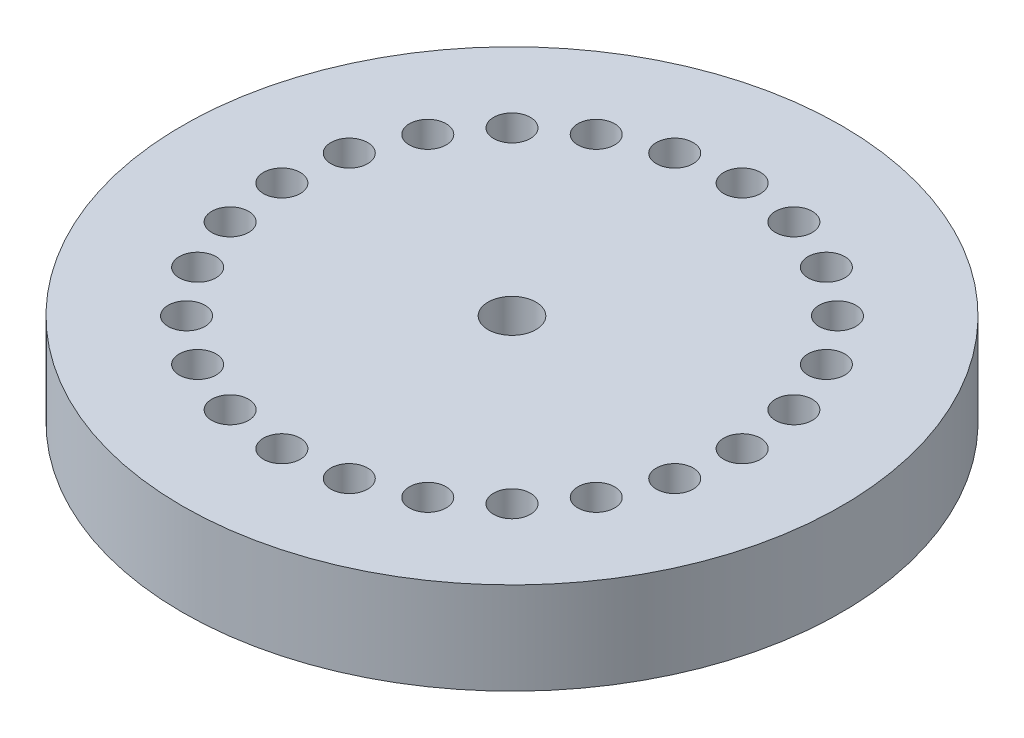
from build123d import *

# Parameters (mm, degrees)
SKETCH1_R                                        = 45.466
BOSS_EXTRUDE1_DEPTH                              = 25.4
SKETCH3_R                                        = 20.32
CUT_EXTRUDE1_DEPTH                               = 12.7
CSK_FOR_1_4_FLAT_HEAD_MACHINE_SCREW1_D           = 6.5278
CSK_FOR_1_4_FLAT_HEAD_MACHINE_SCREW1_DEPTH       = 25.4
CSK_FOR_1_4_FLAT_HEAD_MACHINE_SCREW1_CSINK_D     = 12.8778
CSK_FOR_1_4_FLAT_HEAD_MACHINE_SCREW1_CSINK_ANGLE = 82
CSK_FOR_1_4_FLAT_HEAD_MACHINE_SCREW1_TIP         = 1.961148974
SKETCH8_R                                        = 46.955588052
CUT_EXTRUDE2_DEPTH                               = 12.7
SKETCH4_R                                        = 1.778
CUT_EXTRUDE3_DEPTH                               = 66.540859866
SKETCH9_R                                        = 2.54
CUT_EXTRUDE4_DEPTH                               = 5.08
CIRPATTERN1_COUNT                                = 24
SKETCH10_R                                       = 22.834776664
BOSS_EXTRUDE2_DEPTH                              = 5.08
SKETCH11_R                                       = 3.302
CUT_EXTRUDE5_DEPTH                               = 66.540859866


with BuildPart() as part:
    # Sketch1 → Boss-Extrude1 (new body)
    with BuildSketch(Plane(origin=(0, 0, 0), x_dir=(1, 0, 0), z_dir=(0, 1, 0))):
        Circle(SKETCH1_R)
    extrude(amount=BOSS_EXTRUDE1_DEPTH)

    # Sketch3 → Cut-Extrude1 (cut)
    with BuildSketch(Plane.XZ):
        Circle(SKETCH3_R)
    extrude(amount=-CUT_EXTRUDE1_DEPTH, mode=Mode.SUBTRACT)

    # CSK for 1/4 Flat Head Machine Screw1
    with Locations(Plane(origin=(0, 25.4, 0), x_dir=(1, 0, 0), z_dir=(0, 1, 0))):
        with Locations((0, 0)):
            CounterSinkHole(CSK_FOR_1_4_FLAT_HEAD_MACHINE_SCREW1_D / 2, CSK_FOR_1_4_FLAT_HEAD_MACHINE_SCREW1_CSINK_D / 2, depth=CSK_FOR_1_4_FLAT_HEAD_MACHINE_SCREW1_DEPTH, counter_sink_angle=CSK_FOR_1_4_FLAT_HEAD_MACHINE_SCREW1_CSINK_ANGLE)
            with Locations((0, 0, -(CSK_FOR_1_4_FLAT_HEAD_MACHINE_SCREW1_DEPTH + CSK_FOR_1_4_FLAT_HEAD_MACHINE_SCREW1_TIP / 2))):  # 118° drill point
                Cone(0, CSK_FOR_1_4_FLAT_HEAD_MACHINE_SCREW1_D / 2, CSK_FOR_1_4_FLAT_HEAD_MACHINE_SCREW1_TIP, mode=Mode.SUBTRACT)

    # Sketch8 → Cut-Extrude2 (cut)
    with BuildSketch(Plane(origin=(0, 25.4, 0), x_dir=(1, 0, 0), z_dir=(0, 1, 0))):
        Circle(SKETCH8_R)
    extrude(amount=-CUT_EXTRUDE2_DEPTH, mode=Mode.SUBTRACT)

    # Sketch4 → Cut-Extrude3 (cut, through all)
    with BuildSketch(Plane.XZ):
        with Locations((0, 31.75)):
            Circle(SKETCH4_R)
    cut_extrude3 = extrude(amount=-CUT_EXTRUDE3_DEPTH, mode=Mode.SUBTRACT)

    # Sketch9 → Cut-Extrude4 (cut)
    with BuildSketch(Plane(origin=(0, 12.7, 0), x_dir=(1, 0, 0), z_dir=(0, 1, 0))):
        with Locations((0, -31.75)):
            Circle(SKETCH9_R)
    cut_extrude4 = extrude(amount=-CUT_EXTRUDE4_DEPTH, mode=Mode.SUBTRACT)

    # CirPattern1: Cut-Extrude3, Cut-Extrude4 ×24 about axis
    cirpattern1_axis = Axis((0, 12.7, 0), (0, -1, 0))
    add([cut_extrude3.rotate(cirpattern1_axis, i * 360 / CIRPATTERN1_COUNT) for i in range(1, CIRPATTERN1_COUNT)], mode=Mode.SUBTRACT)
    add([cut_extrude4.rotate(cirpattern1_axis, i * 360 / CIRPATTERN1_COUNT) for i in range(1, CIRPATTERN1_COUNT)], mode=Mode.SUBTRACT)

    # Sketch10 → Boss-Extrude2 (add)
    with BuildSketch(Plane(origin=(0, 12.7, 0), x_dir=(1, 0, 0), z_dir=(0, 1, 0))):
        Circle(SKETCH10_R)
    extrude(amount=-BOSS_EXTRUDE2_DEPTH)

    # Sketch11 → Cut-Extrude5 (cut, through all)
    with BuildSketch(Plane(origin=(0, 12.7, 0), x_dir=(1, 0, 0), z_dir=(0, 1, 0))):
        Circle(SKETCH11_R)
    extrude(amount=-CUT_EXTRUDE5_DEPTH, mode=Mode.SUBTRACT)


solid = part.part
